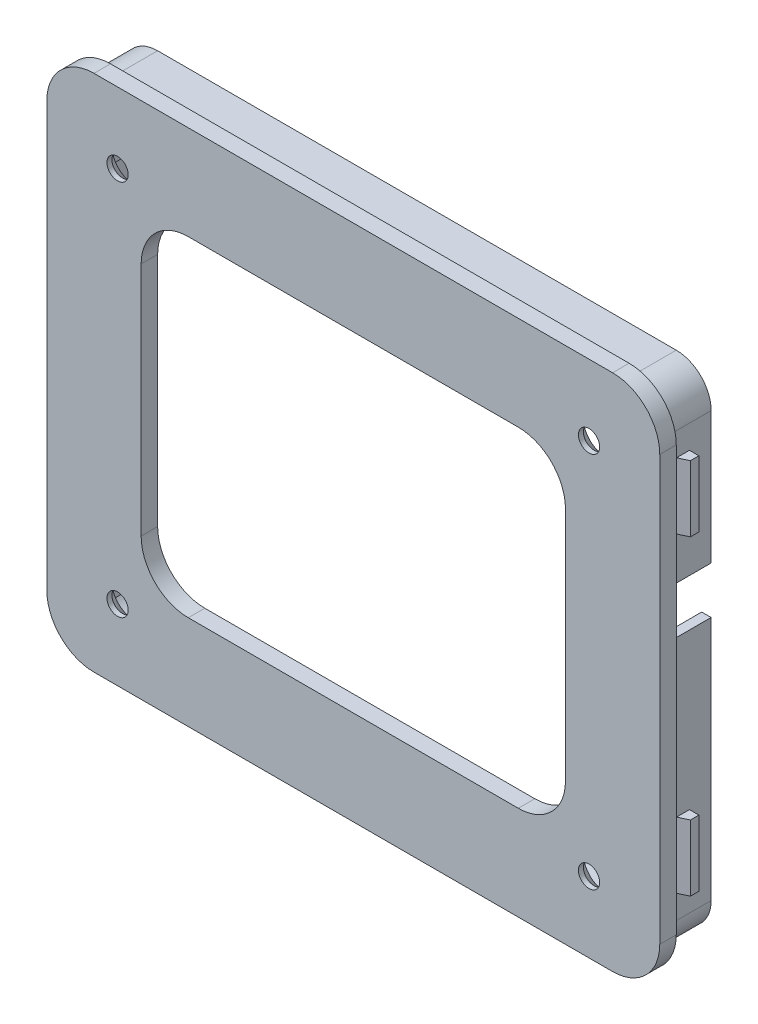
from build123d import *

# Parameters (mm, degrees)
P_IDAT_VYSUNUT_M2_DEPTH                           = 3.5
P_IDAT_VYSUNUT_M3_DEPTH                           = 10
V_LCOV_ZAHLOUBEN_PRO_M4_ROUBY_S_P_2_COUNT         = 2
V_LCOV_ZAHLOUBEN_PRO_M4_ROUBY_S_P_2_PITCH         = 100
V_LCOV_ZAHLOUBEN_PRO_M4_ROUBY_S_P_3_COUNT         = 2
V_LCOV_ZAHLOUBEN_PRO_M4_ROUBY_S_P_3_PITCH         = 128.062484749
V_LCOV_ZAHLOUBEN_PRO_M4_ROUBY_S_P_4_COUNT         = 2
V_LCOV_ZAHLOUBEN_PRO_M4_ROUBY_S_P_4_PITCH         = 80
ODEBRAT_VYSUNUT_M2_DEPTH                          = 86.732140997
SKICA8_W                                          = 5
SKICA8_H                                          = 8
SKICA8_W_2                                        = 3
SKICA8_W_3                                        = 8
P_IDAT_VYSUNUT_M4_DEPTH                           = 5
V_LCOV_ZAHLOUBEN_PRO_M3_ROUBY_S_V_LCO_D           = 3.4
V_LCOV_ZAHLOUBEN_PRO_M3_ROUBY_S_V_LCO_DEPTH       = 9.6
V_LCOV_ZAHLOUBEN_PRO_M3_ROUBY_S_V_LCO_CBORE_D     = 3.9
V_LCOV_ZAHLOUBEN_PRO_M3_ROUBY_S_V_LCO_CBORE_DEPTH = 4
SKICA15_W                                         = 2.8
SKICA15_H                                         = 14
P_IDAT_VYSUNUT_M5_DEPTH                           = 2
ZKOSEN_1_SIZE                                     = 2.144506921
ZKOSEN_1_SIZE_2                                   = 1
ZKOSEN_2_SIZE                                     = 1
ZKOSEN_2_SIZE_2                                   = 2.144506921


with BuildPart() as part:
    # Skica1 → Přidat vysunutím2 (new body)
    with BuildSketch(Plane.XY):
        with BuildLine():
            Line((-55, 55), (55, 55))
            ThreePointArc((55, 55), (62.071067812, 52.071067812), (65, 45))
            Line((65, 45), (65, -45))
            ThreePointArc((65, -45), (62.071067812, -52.071067812), (55, -55))
            Line((55, -55), (-55, -55))
            ThreePointArc((-55, -55), (-62.071067812, -52.071067812), (-65, -45))
            Line((-65, -45), (-65, 45))
            ThreePointArc((-65, 45), (-62.071067812, 52.071067812), (-55, 55))
        make_face()
    extrude(amount=P_IDAT_VYSUNUT_M2_DEPTH)

    # Skica3 → Přidat vysunutím3 (add)
    with BuildSketch(Plane(origin=(0, 0, 0), x_dir=(-1, 0, 0), z_dir=(0, 0, -1))):
        with BuildLine():
            Line((-60.4, 17), (-60.4, 45))
            ThreePointArc((-60.4, 45), (-58.818376618, 48.818376618), (-55, 50.4))
            Line((-55, 50.4), (55, 50.4))
            ThreePointArc((55, 50.4), (58.818376618, 48.818376618), (60.4, 45))
            Line((60.4, 45), (60.4, -45))
            ThreePointArc((60.4, -45), (58.818376618, -48.818376618), (55, -50.4))
            Line((55, -50.4), (-55, -50.4))
            ThreePointArc((-55, -50.4), (-58.818376618, -48.818376618), (-60.4, -45))
            Line((-60.4, -45), (-60.4, 7))
            Line((-60.4, 7), (-62.4, 7))
            Line((-62.4, 7), (-62.4, -45))
            ThreePointArc((-62.4, -45), (-60.232590181, -50.232590181), (-55, -52.4))
            Line((-55, -52.4), (55, -52.4))
            ThreePointArc((55, -52.4), (60.232590181, -50.232590181), (62.4, -45))
            Line((62.4, -45), (62.4, 45))
            ThreePointArc((62.4, 45), (60.232590181, 50.232590181), (55, 52.4))
            Line((55, 52.4), (-55, 52.4))
            ThreePointArc((-55, 52.4), (-60.232590181, 50.232590181), (-62.4, 45))
            Line((-62.4, 45), (-62.4, 17))
            Line((-62.4, 17), (-60.4, 17))
        make_face()
    extrude(amount=P_IDAT_VYSUNUT_M3_DEPTH)

    # Skica5 → Válcové zahloubení pro M4 šrouby s plochou hlavou1 (revolve, cut)
    with BuildSketch(Plane(origin=(-50, -40, 0), x_dir=(0, 1, 0), z_dir=(1, 0, 0))):
        Polygon((0, 0), (0, 3.5), (2.25, 3.5), (2.25, 2.45), (4.7, 0), align=None)
    v_lcov_zahlouben_pro_m4_rouby_s_ploch = revolve(axis=Axis((-50, -40, -6.35), (0, 0, 1)), mode=Mode.SUBTRACT)

    # V_lcov_ zahlouben_ pro M4 _rouby s p 2: Válcové zahloubení pro M4 šrouby s plochou hlavou1 ×2
    with Locations(*[(i * V_LCOV_ZAHLOUBEN_PRO_M4_ROUBY_S_P_2_PITCH, 0, 0) for i in range(1, V_LCOV_ZAHLOUBEN_PRO_M4_ROUBY_S_P_2_COUNT)]):
        add(v_lcov_zahlouben_pro_m4_rouby_s_ploch, mode=Mode.SUBTRACT)

    # V_lcov_ zahlouben_ pro M4 _rouby s p 3: Válcové zahloubení pro M4 šrouby s plochou hlavou1 ×2
    with Locations(*[Vector(0.7808688094430304, 0.6246950475544243, 0) * (i * V_LCOV_ZAHLOUBEN_PRO_M4_ROUBY_S_P_3_PITCH) for i in range(1, V_LCOV_ZAHLOUBEN_PRO_M4_ROUBY_S_P_3_COUNT)]):
        add(v_lcov_zahlouben_pro_m4_rouby_s_ploch, mode=Mode.SUBTRACT)

    # V_lcov_ zahlouben_ pro M4 _rouby s p 4: Válcové zahloubení pro M4 šrouby s plochou hlavou1 ×2
    with Locations(*[(0, i * V_LCOV_ZAHLOUBEN_PRO_M4_ROUBY_S_P_4_PITCH, 0) for i in range(1, V_LCOV_ZAHLOUBEN_PRO_M4_ROUBY_S_P_4_COUNT)]):
        add(v_lcov_zahlouben_pro_m4_rouby_s_ploch, mode=Mode.SUBTRACT)

    # Skica6 → Odebrat vysunutím2 (cut, through all)
    with BuildSketch(Plane(origin=(0, 0, 0), x_dir=(-1, 0, 0), z_dir=(0, 0, -1))):
        with BuildLine():
            Line((-35, -35), (35, -35))
            ThreePointArc((35, -35), (42.071067812, -32.071067812), (45, -25))
            Line((45, -25), (45, 25))
            ThreePointArc((45, 25), (42.071067812, 32.071067812), (35, 35))
            Line((35, 35), (-35, 35))
            ThreePointArc((-35, 35), (-42.071067812, 32.071067812), (-45, 25))
            Line((-45, 25), (-45, -25))
            ThreePointArc((-45, -25), (-42.071067812, -32.071067812), (-35, -35))
        make_face()
    extrude(amount=-ODEBRAT_VYSUNUT_M2_DEPTH, mode=Mode.SUBTRACT)

    # Skica8 → Přidat vysunutím4 (add)
    with BuildSketch(Plane(origin=(-60.4, 0, 0), x_dir=(0, 0, -1), z_dir=(1, 0, 0))):
        with Locations((2.5, 40)):
            Rectangle(SKICA8_W, SKICA8_H)
        with Locations((6.5, 40)):
            Rectangle(SKICA8_W_2, SKICA8_H)
        with Locations((4, -40)):
            Rectangle(SKICA8_W_3, SKICA8_H)
    extrude(amount=P_IDAT_VYSUNUT_M4_DEPTH)

    # Válcové zahloubení pro M3 šrouby s válcovou hlavou zaoblenou1
    with Locations(Plane(origin=(-55.4, 40, -4), x_dir=(0, 0, 1), z_dir=(1, 0, 0))):
        with Locations((0, 0)):
            v_lcov_zahlouben_pro_m3_rouby_s_v_lco = CounterBoreHole(V_LCOV_ZAHLOUBEN_PRO_M3_ROUBY_S_V_LCO_D / 2, V_LCOV_ZAHLOUBEN_PRO_M3_ROUBY_S_V_LCO_CBORE_D / 2, V_LCOV_ZAHLOUBEN_PRO_M3_ROUBY_S_V_LCO_CBORE_DEPTH, depth=V_LCOV_ZAHLOUBEN_PRO_M3_ROUBY_S_V_LCO_DEPTH)

    # Zrcadlit1: Válcové zahloubení pro M3 šrouby s válcovou hlavou zaoblenou1 across plane
    add(v_lcov_zahlouben_pro_m3_rouby_s_v_lco.mirror(Plane.ZX), mode=Mode.SUBTRACT)

    # Skica15 → Přidat vysunutím5 (add)
    with BuildSketch(Plane(origin=(62.4, 0, 0), x_dir=(0, 0, -1), z_dir=(1, 0, 0))):
        with Locations((4, 33)):
            Rectangle(SKICA15_W, SKICA15_H)
        with Locations((4, -33)):
            Rectangle(SKICA15_W, SKICA15_H)
    extrude(amount=P_IDAT_VYSUNUT_M5_DEPTH)

    # Zkosení1
    # the kernel refuses this chamfer: 2.144506921, 1 mm, written as the material it takes off along each edge
    with BuildSketch(Plane(origin=(64.4, -45.556364829, -2.6), x_dir=(-0.9998669641130703, 0, 0.016311164131110292), z_dir=(0, 1, 0))) as zkosen_1_piece_1_section:
        Polygon((ZKOSEN_1_SIZE * 0.999866963884, -ZKOSEN_1_SIZE * 0.0163111641274), (-ZKOSEN_1_SIZE_2 * 0.0163111641311, -ZKOSEN_1_SIZE_2 * 0.999866964113), (0, 0), align=None)
    zkosen_1_piece_1 = extrude(amount=25.112729659, mode=Mode.PRIVATE)
    zkosen_1_piece_1 = split(zkosen_1_piece_1, bisect_by=Plane(origin=(62.4, -33, -2.920893851), z_dir=(1, 0, 0)), keep=Keep.TOP, mode=Mode.PRIVATE)
    add(zkosen_1_piece_1, mode=Mode.SUBTRACT)

    # Zkosení2
    # the kernel refuses this chamfer: 2.144506921, 1 mm, written as the material it takes off along each edge
    with BuildSketch(Plane(origin=(64.4, 20.443635171, -2.6), x_dir=(0.07481330637059905, 0, -0.9971975577536776), z_dir=(0, 1, 0))) as zkosen_2_piece_1_section:
        Polygon((ZKOSEN_2_SIZE * 0.997197557754, ZKOSEN_2_SIZE * 0.0748133063706), (-ZKOSEN_2_SIZE_2 * 0.0748133063535, ZKOSEN_2_SIZE_2 * 0.997197557526), (0, 0), align=None)
    zkosen_2_piece_1 = extrude(amount=25.112729659, mode=Mode.PRIVATE)
    zkosen_2_piece_1 = split(zkosen_2_piece_1, bisect_by=Plane(origin=(62.4, 33, -2.920893851), z_dir=(1, 0, 0)), keep=Keep.TOP, mode=Mode.PRIVATE)
    add(zkosen_2_piece_1, mode=Mode.SUBTRACT)


solid = part.part
